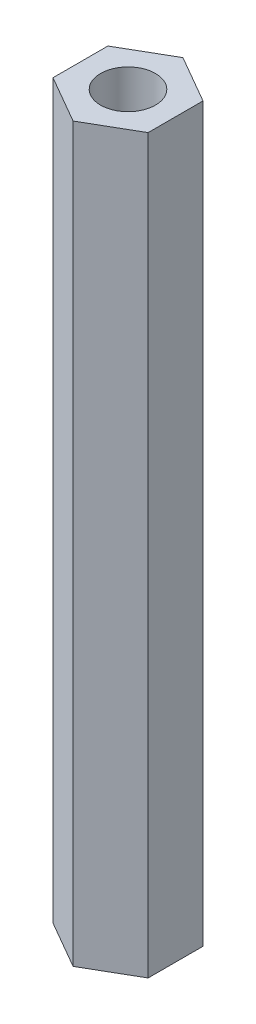
from build123d import *

# Parameters (mm, degrees)
SKETCH1_R           = 1.5
BOSS_EXTRUDE1_DEPTH = 40


with BuildPart() as part:
    # Sketch1 → Boss-Extrude1 (new body)
    with BuildSketch(Plane(origin=(0, 0, 0), x_dir=(1, 0, 0), z_dir=(0, 1, 0))):
        Polygon((0, 3), (-2.598076211, 1.5), (-2.598076211, -1.5), (0, -3), (2.598076211, -1.5), (2.598076211, 1.5), align=None)
        Circle(SKETCH1_R, mode=Mode.SUBTRACT)
    extrude(amount=BOSS_EXTRUDE1_DEPTH)


solid = part.part
